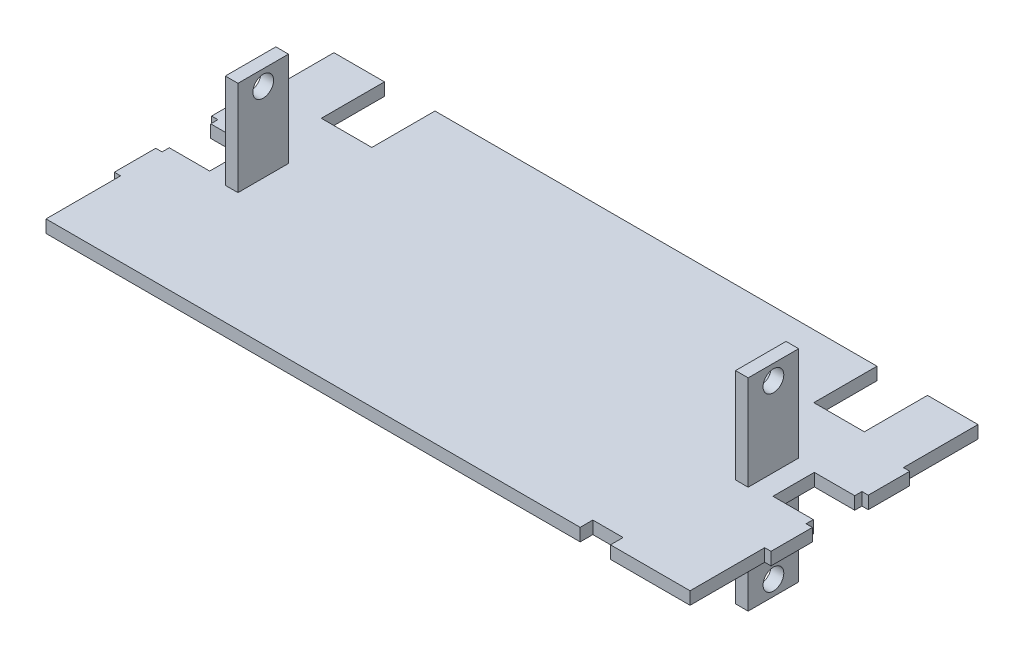
from build123d import *

# Parameters (mm, degrees)
BOSS_EXTRUDE1_DEPTH     = 3.175
SKETCH2_W               = 6.35
SKETCH2_H               = 25.4
BOSS_EXTRUDE2_DEPTH     = 50.8
CUT_EXTRUDE1_DEPTH      = 310.45094785
CUT_EXTRUDE1_DEPTH_BACK = 310.45094785
SKETCH3_R               = 5.207


with BuildPart() as part:
    # Sketch1 → Boss-Extrude1 (new, symmetric)
    with BuildSketch(Plane(origin=(0, 0, 0), x_dir=(1, 0, 0), z_dir=(0, 1, 0))):
        Polygon((161.925, -72.39), (121.92, -72.39), (121.92, -66.04), (106.68, -66.04), (106.68, -72.39), (-161.925, -72.39), (-161.925, -34.874677354), (-165.1, -34.874677354), (-165.1, -14.046677354), (-161.925, -14.046677354), (-161.925, -10.414), (-141.605, -10.414), (-141.605, 10.414), (-161.925, 10.414), (-161.925, 14.046677354), (-165.1, 14.046677354), (-165.1, 34.874677354), (-161.925, 34.874677354), (-161.925, 72.39), (-136.525, 72.39), (-136.525, 40.64), (-111.125, 40.64), (-111.125, 72.39), (111.125, 72.39), (111.125, 40.64), (136.525, 40.64), (136.525, 72.39), (161.925, 72.39), (161.925, 34.874677354), (165.1, 34.874677354), (165.1, 14.046677354), (161.925, 14.046677354), (161.925, 10.414), (141.605, 10.414), (141.605, -10.414), (161.925, -10.414), (161.925, -14.046677354), (165.1, -14.046677354), (165.1, -34.874677354), (161.925, -34.874677354), align=None)
    extrude(amount=BOSS_EXTRUDE1_DEPTH, both=True)

    # Sketch2 → Boss-Extrude2 (add, symmetric)
    with BuildSketch(Plane(origin=(0, 0, 0), x_dir=(1, 0, 0), z_dir=(0, 1, 0))):
        with Locations((128.27, 0)):
            Rectangle(SKETCH2_W, SKETCH2_H)
        with Locations((-128.27, 0)):
            Rectangle(SKETCH2_W, SKETCH2_H)
    extrude(amount=BOSS_EXTRUDE2_DEPTH, both=True)

    # Sketch3 → Cut-Extrude1 (cut, two sides: drawn at the far end of the back side and taken through both)
    with BuildSketch(Plane.ZY.offset(131.445).offset(-CUT_EXTRUDE1_DEPTH_BACK)):
        with Locations((0, 43.18)):
            Circle(SKETCH3_R)
        with Locations((0, -43.18)):
            Circle(SKETCH3_R)
    extrude(amount=CUT_EXTRUDE1_DEPTH + CUT_EXTRUDE1_DEPTH_BACK, mode=Mode.SUBTRACT)


solid = part.part
